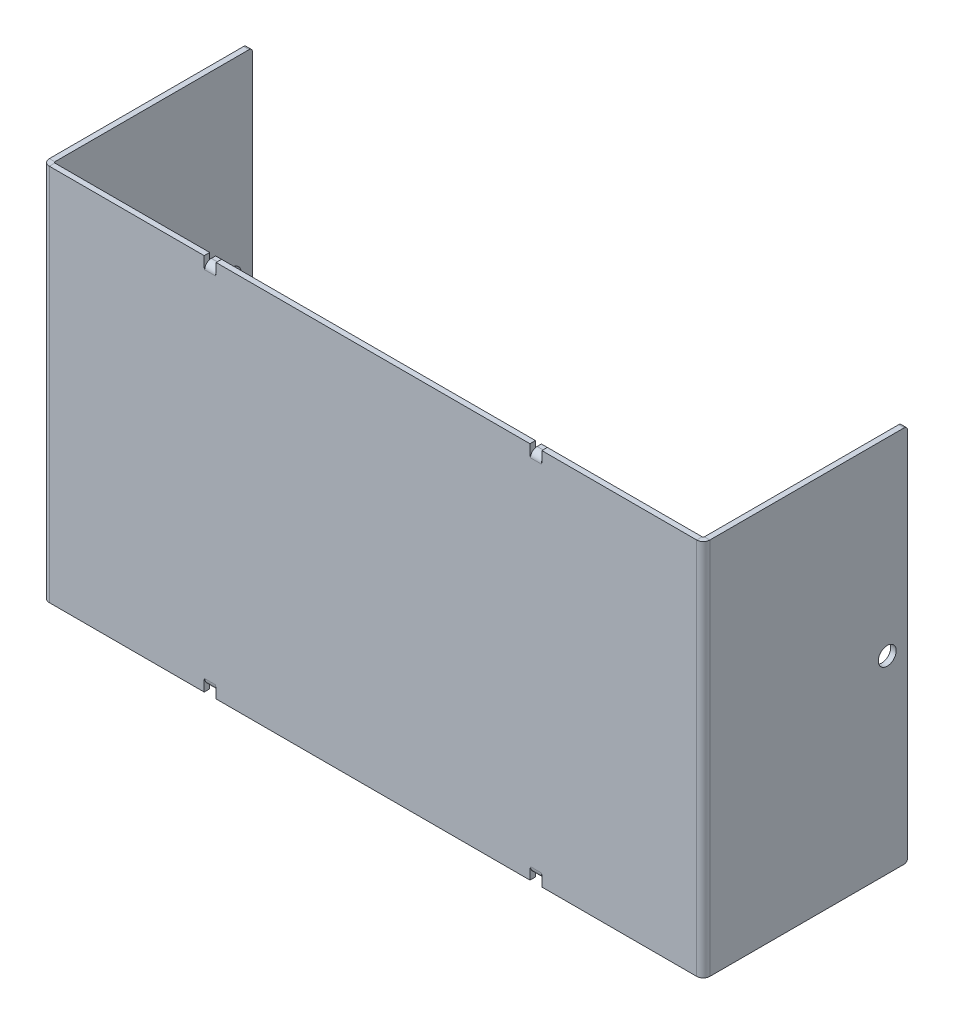
from build123d import *

# Parameters (mm, degrees)
SKETCH1_W                                    = 152.4
SKETCH1_H                                    = 88.9
BASE_FLANGE1_DEPTH                           = 1.29032
EDGE_FLANGE1_STRIP_W                         = 5.85978
EDGE_FLANGE1_STRIP_H                         = 1.29032
EDGE_FLANGE1_STRIP_CUT_DEPTH                 = 88.9
EDGE_FLANGE1_STRIP_2_W                       = 5.85978
EDGE_FLANGE1_STRIP_2_H                       = 1.29032
EDGE_FLANGE1_STRIP_CUT_2_DEPTH               = 88.9
EDGE_FLANGE1_DEPTH                           = 88.9
EDGE_FLANGE1_BEND_DEPTH                      = 88.9
F_4_22MM_HOLE_FOR_M3_CLINCH_NUT_D            = 4.22
BREAK_CORNER1_START                          = -77.68082
BREAK_CORNER1_DEPTH                          = 155.36164
CUT_THICKEN1_START                           = 41.91
CUT_THICKEN1_OUTLINE_W                       = 0.127
CUT_THICKEN1_OUTLINE_H                       = 1.29032
CUT_THICKEN1_DEPTH                           = 2.54
CUT_THICKEN2_START                           = 41.91
CUT_THICKEN2_OUTLINE_W                       = 0.127
CUT_THICKEN2_OUTLINE_H                       = 1.29032
CUT_THICKEN2_DEPTH                           = 2.54
MIRROR7_START                                = 41.91
MIRROR7_COPY_1_SKETCH_W                      = 0.127
MIRROR7_COPY_1_SKETCH_H                      = 1.29032
MIRROR7_COPY_1_DEPTH                         = 2.54
MIRROR7_COPY_2_SKETCH_W                      = 0.127
MIRROR7_COPY_2_SKETCH_H                      = 1.29032
MIRROR7_COPY_2_DEPTH                         = 2.54
MOVE_FACE1_BY                                = 1.27
MOVE_FACE1_2_BY                              = 1.27
MOVE_FACE1_3_BY                              = 1.27
MOVE_FACE1_4_BY                              = 1.27
EDGE_FLANGE2_STRIP_W                         = 5.66928
EDGE_FLANGE2_STRIP_H                         = 1.29032
EDGE_FLANGE2_STRIP_CUT_DEPTH                 = 2.54
EDGE_FLANGE2_STRIP_2_W                       = 5.66928
EDGE_FLANGE2_STRIP_2_H                       = 1.29032
EDGE_FLANGE2_STRIP_CUT_2_DEPTH               = 2.54
EDGE_FLANGE2_STRIP_3_W                       = 5.66928
EDGE_FLANGE2_STRIP_3_H                       = 1.29032
EDGE_FLANGE2_STRIP_CUT_3_DEPTH               = 2.54
EDGE_FLANGE2_STRIP_4_W                       = 5.66928
EDGE_FLANGE2_STRIP_4_H                       = 1.29032
EDGE_FLANGE2_STRIP_CUT_4_DEPTH               = 2.54
EDGE_FLANGE2_DEPTH                           = 2.54
EDGE_FLANGE2_BEND_DEPTH                      = 2.54
EDGE_FLANGE2_BEND_2_DEPTH                    = 2.54
EDGE_FLANGE2_BEND_3_DEPTH                    = 2.54
CHANGE_START                                 = -77.68082
CHANGE_NOTE_FOR_REVH_TO_ADD_010_CLEARA_DEPTH = 155.36164


# Read off the part's stored shape, not the designer's step: Break-Corner1, Cut-Thicken1, Cut-Thicken2, change note for revH to add .010" clearance
# Sheet-metal steps are written as plain solids
with BuildPart() as part:
    # Sketch1 → Base-Flange1 (new body)
    with BuildSketch(Plane.XY):
        Rectangle(SKETCH1_W, SKETCH1_H)
    extrude(amount=-BASE_FLANGE1_DEPTH)

    # Edge-Flange1 strip (across the edge) → Edge-Flange1 strip cut (cut)
    with BuildSketch(Plane(origin=(-76.3905, -44.45, -1.29032), x_dir=(1, 0, 0), z_dir=(0, 1, 0))):
        with Locations((-2.67589, -0.64516)):
            Rectangle(EDGE_FLANGE1_STRIP_W, EDGE_FLANGE1_STRIP_H)
    extrude(amount=EDGE_FLANGE1_STRIP_CUT_DEPTH, mode=Mode.SUBTRACT)

    # Edge-Flange1 strip 2 (across the edge) → Edge-Flange1 strip cut 2 (cut)
    with BuildSketch(Plane(origin=(76.3905, 44.45, -1.29032), x_dir=(-1, 0, 0), z_dir=(0, -1, 0))):
        with Locations((-2.67589, -0.64516)):
            Rectangle(EDGE_FLANGE1_STRIP_2_W, EDGE_FLANGE1_STRIP_2_H)
    extrude(amount=EDGE_FLANGE1_STRIP_CUT_2_DEPTH, mode=Mode.SUBTRACT)

    # Edge-Flange1 section (across the edge) → Edge-Flange1 (add)
    with BuildSketch(Plane(origin=(-76.3905, -44.45, -1.29032), x_dir=(1, 0, 0), z_dir=(0, 1, 0))):
        with BuildLine():
            Line((-1.29032, 0.254), (-1.29032, 46.96968))
            Line((-1.29032, 46.96968), (0, 46.96968))
            Line((0, 46.96968), (0, 0.254))
            ThreePointArc((0, 0.254), (0.074394878, 0.074394878), (0.254, 0))
            Line((0.254, 0), (0.254, -1.29032))
            ThreePointArc((0.254, -1.29032), (-0.837999144, -0.837999144), (-1.29032, 0.254))
        make_face()
    extrude(amount=EDGE_FLANGE1_DEPTH)

    # Edge-Flange1 section 2 (across the edge) → Edge-Flange1 bend (add)
    with BuildSketch(Plane(origin=(76.3905, 44.45, -1.29032), x_dir=(-1, 0, 0), z_dir=(0, -1, 0))):
        with BuildLine():
            Line((-1.29032, 0.254), (-1.29032, 46.96968))
            Line((-1.29032, 46.96968), (0, 46.96968))
            Line((0, 46.96968), (0, 0.254))
            ThreePointArc((0, 0.254), (0.074394878, 0.074394878), (0.254, 0))
            Line((0.254, 0), (0.254, -1.29032))
            ThreePointArc((0.254, -1.29032), (-0.837999144, -0.837999144), (-1.29032, 0.254))
        make_face()
    extrude(amount=EDGE_FLANGE1_BEND_DEPTH)

    # Ø4.22mm hole for M3 Clinch nut (through all)
    with Locations(Plane.ZY.offset(77.68082)):
        with Locations((-43.26, 0)):
            f_4_22mm_hole_for_m3_clinch_nut = Hole(F_4_22MM_HOLE_FOR_M3_CLINCH_NUT_D / 2)

    # Mirror1: Ø4.22mm hole for M3 Clinch nut across plane
    add(f_4_22mm_hole_for_m3_clinch_nut.mirror(Plane(origin=(0, 0, 0), x_dir=(0, 0, 1), z_dir=(1, 0, 0))), mode=Mode.SUBTRACT)

    # Break-Corner1 outline → Break-Corner1 (cut)
    with BuildSketch(Plane.YZ.offset(BREAK_CORNER1_START)):
        with BuildLine():
            Line((44.45, -48.26), (44.45, -47.498))
            ThreePointArc((44.45, -47.498), (44.226815367, -48.036815367), (43.688, -48.26))
            Line((43.688, -48.26), (44.45, -48.26))
        make_face()
        with BuildLine():
            Line((-44.45, -48.26), (-43.688, -48.26))
            ThreePointArc((-43.688, -48.26), (-44.226815367, -48.036815367), (-44.45, -47.498))
            Line((-44.45, -47.498), (-44.45, -48.26))
        make_face()
    extrude(amount=BREAK_CORNER1_DEPTH, mode=Mode.SUBTRACT)

    # Cut-Thicken1 outline → Cut-Thicken1 (cut)
    with BuildSketch(Plane(origin=(0, 0, 0), x_dir=(1, 0, 0), z_dir=(0, 1, 0)).offset(CUT_THICKEN1_START)):
        with Locations((36.97732, 0.64516)):
            Rectangle(CUT_THICKEN1_OUTLINE_W, CUT_THICKEN1_OUTLINE_H)
    cut_thicken1 = extrude(amount=CUT_THICKEN1_DEPTH, mode=Mode.SUBTRACT)

    # Cut-Thicken2 outline → Cut-Thicken2 (cut)
    with BuildSketch(Plane(origin=(0, 0, 0), x_dir=(1, 0, 0), z_dir=(0, 1, 0)).offset(CUT_THICKEN2_START)):
        with Locations((39.64432, 0.64516)):
            Rectangle(CUT_THICKEN2_OUTLINE_W, CUT_THICKEN2_OUTLINE_H)
    cut_thicken2 = extrude(amount=CUT_THICKEN2_DEPTH, mode=Mode.SUBTRACT)

    # Mirror6: Cut-Thicken1, Cut-Thicken2 across plane
    add(cut_thicken1.mirror(Plane(origin=(0, 0, 0), x_dir=(0, 0, 1), z_dir=(1, 0, 0))), mode=Mode.SUBTRACT)
    add(cut_thicken2.mirror(Plane(origin=(0, 0, 0), x_dir=(0, 0, 1), z_dir=(1, 0, 0))), mode=Mode.SUBTRACT)

    # Mirror7: Cut-Thicken1, Cut-Thicken2 across plane
    add(cut_thicken1.mirror(Plane.ZX), mode=Mode.SUBTRACT)
    add(cut_thicken2.mirror(Plane.ZX), mode=Mode.SUBTRACT)

    # Mirror7 copy 1 sketch → Mirror7 copy 1 (cut)
    with BuildSketch(Plane(origin=(0, 0, 0), x_dir=(-1, 0, 0), z_dir=(0, -1, 0)).offset(MIRROR7_START)):
        with Locations((36.97732, 0.64516)):
            Rectangle(MIRROR7_COPY_1_SKETCH_W, MIRROR7_COPY_1_SKETCH_H)
    extrude(amount=MIRROR7_COPY_1_DEPTH, mode=Mode.SUBTRACT)

    # Mirror7 copy 2 sketch → Mirror7 copy 2 (cut)
    with BuildSketch(Plane(origin=(0, 0, 0), x_dir=(-1, 0, 0), z_dir=(0, -1, 0)).offset(MIRROR7_START)):
        with Locations((39.64432, 0.64516)):
            Rectangle(MIRROR7_COPY_2_SKETCH_W, MIRROR7_COPY_2_SKETCH_H)
    extrude(amount=MIRROR7_COPY_2_DEPTH, mode=Mode.SUBTRACT)

    # Move Face1: a face moved inward by 1.27
    extrude(part.faces().sort_by_distance((-38.31082, -44.45, -0.64516))[0], amount=MOVE_FACE1_BY, dir=(0, 1, 0), mode=Mode.SUBTRACT)

    # Move Face1 2: a face moved inward by 1.27
    extrude(part.faces().sort_by_distance((38.31082, -44.45, -0.64516))[0], amount=MOVE_FACE1_2_BY, dir=(0, 1, 0), mode=Mode.SUBTRACT)

    # Move Face1 3: a face moved inward by 1.27
    extrude(part.faces().sort_by_distance((-38.31082, 44.45, -0.64516))[0], amount=MOVE_FACE1_3_BY, dir=(0, -1, 0), mode=Mode.SUBTRACT)

    # Move Face1 4: a face moved inward by 1.27
    extrude(part.faces().sort_by_distance((38.31082, 44.45, -0.64516))[0], amount=MOVE_FACE1_4_BY, dir=(0, -1, 0), mode=Mode.SUBTRACT)

    # Edge-Flange2 strip (across the edge) → Edge-Flange2 strip cut (cut)
    with BuildSketch(Plane(origin=(37.04082, 43.18, -1.29032), x_dir=(0, -1, 0), z_dir=(1, 0, 0))):
        with Locations((-1.29032, -0.64516)):
            Rectangle(EDGE_FLANGE2_STRIP_W, EDGE_FLANGE2_STRIP_H)
    extrude(amount=EDGE_FLANGE2_STRIP_CUT_DEPTH, mode=Mode.SUBTRACT)

    # Edge-Flange2 strip 2 (across the edge) → Edge-Flange2 strip cut 2 (cut)
    with BuildSketch(Plane(origin=(-39.58082, 43.18, -1.29032), x_dir=(0, -1, 0), z_dir=(1, 0, 0))):
        with Locations((-1.29032, -0.64516)):
            Rectangle(EDGE_FLANGE2_STRIP_2_W, EDGE_FLANGE2_STRIP_2_H)
    extrude(amount=EDGE_FLANGE2_STRIP_CUT_2_DEPTH, mode=Mode.SUBTRACT)

    # Edge-Flange2 strip 3 (across the edge) → Edge-Flange2 strip cut 3 (cut)
    with BuildSketch(Plane(origin=(39.58082, -43.18, -1.29032), x_dir=(0, 1, 0), z_dir=(-1, 0, 0))):
        with Locations((-1.29032, -0.64516)):
            Rectangle(EDGE_FLANGE2_STRIP_3_W, EDGE_FLANGE2_STRIP_3_H)
    extrude(amount=EDGE_FLANGE2_STRIP_CUT_3_DEPTH, mode=Mode.SUBTRACT)

    # Edge-Flange2 strip 4 (across the edge) → Edge-Flange2 strip cut 4 (cut)
    with BuildSketch(Plane(origin=(-37.04082, -43.18, -1.29032), x_dir=(0, 1, 0), z_dir=(-1, 0, 0))):
        with Locations((-1.29032, -0.64516)):
            Rectangle(EDGE_FLANGE2_STRIP_4_W, EDGE_FLANGE2_STRIP_4_H)
    extrude(amount=EDGE_FLANGE2_STRIP_CUT_4_DEPTH, mode=Mode.SUBTRACT)

    # Edge-Flange2 section (across the edge) → Edge-Flange2 (add)
    with BuildSketch(Plane(origin=(37.04082, 43.18, -1.29032), x_dir=(0, -1, 0), z_dir=(1, 0, 0))):
        with BuildLine():
            Line((0, 0.254), (0, 1.27))
            Line((0, 1.27), (1.29032, 1.27))
            Line((1.29032, 1.27), (1.29032, 0.254))
            ThreePointArc((1.29032, 0.254), (1.364714878, 0.074394878), (1.54432, 0))
            Line((1.54432, 0), (1.54432, -1.29032))
            ThreePointArc((1.54432, -1.29032), (0.452320856, -0.837999144), (0, 0.254))
        make_face()
    extrude(amount=EDGE_FLANGE2_DEPTH)

    # Edge-Flange2 section 2 (across the edge) → Edge-Flange2 bend (add)
    with BuildSketch(Plane(origin=(-39.58082, 43.18, -1.29032), x_dir=(0, -1, 0), z_dir=(1, 0, 0))):
        with BuildLine():
            Line((0, 0.254), (0, 1.27))
            Line((0, 1.27), (1.29032, 1.27))
            Line((1.29032, 1.27), (1.29032, 0.254))
            ThreePointArc((1.29032, 0.254), (1.364714878, 0.074394878), (1.54432, 0))
            Line((1.54432, 0), (1.54432, -1.29032))
            ThreePointArc((1.54432, -1.29032), (0.452320856, -0.837999144), (0, 0.254))
        make_face()
    extrude(amount=EDGE_FLANGE2_BEND_DEPTH)

    # Edge-Flange2 section 3 (across the edge) → Edge-Flange2 bend 2 (add)
    with BuildSketch(Plane(origin=(39.58082, -43.18, -1.29032), x_dir=(0, 1, 0), z_dir=(-1, 0, 0))):
        with BuildLine():
            Line((0, 0.254), (0, 1.27))
            Line((0, 1.27), (1.29032, 1.27))
            Line((1.29032, 1.27), (1.29032, 0.254))
            ThreePointArc((1.29032, 0.254), (1.364714878, 0.074394878), (1.54432, 0))
            Line((1.54432, 0), (1.54432, -1.29032))
            ThreePointArc((1.54432, -1.29032), (0.452320856, -0.837999144), (0, 0.254))
        make_face()
    extrude(amount=EDGE_FLANGE2_BEND_2_DEPTH)

    # Edge-Flange2 section 4 (across the edge) → Edge-Flange2 bend 3 (add)
    with BuildSketch(Plane(origin=(-37.04082, -43.18, -1.29032), x_dir=(0, 1, 0), z_dir=(-1, 0, 0))):
        with BuildLine():
            Line((0, 0.254), (0, 1.27))
            Line((0, 1.27), (1.29032, 1.27))
            Line((1.29032, 1.27), (1.29032, 0.254))
            ThreePointArc((1.29032, 0.254), (1.364714878, 0.074394878), (1.54432, 0))
            Line((1.54432, 0), (1.54432, -1.29032))
            ThreePointArc((1.54432, -1.29032), (0.452320856, -0.837999144), (0, 0.254))
        make_face()
    extrude(amount=EDGE_FLANGE2_BEND_3_DEPTH)

    # change note for revH to add .010_ cl 2 → change note for revH to add .010" clearance (cut)
    with BuildSketch(Plane.YZ.offset(CHANGE_START)):
        with BuildLine():
            Line((43.688, -48.006), (-43.688, -48.006))
            ThreePointArc((-43.688, -48.006), (-44.226815367, -47.782815367), (-44.45, -47.244))
            Line((-44.45, -47.244), (-44.45, -47.498))
            ThreePointArc((-44.45, -47.498), (-44.226815367, -48.036815367), (-43.688, -48.26))
            Line((-43.688, -48.26), (43.688, -48.26))
            ThreePointArc((43.688, -48.26), (44.226815367, -48.036815367), (44.45, -47.498))
            Line((44.45, -47.498), (44.45, -47.244))
            ThreePointArc((44.45, -47.244), (44.226815367, -47.782815367), (43.688, -48.006))
        make_face()
    extrude(amount=CHANGE_NOTE_FOR_REVH_TO_ADD_010_CLEARA_DEPTH, mode=Mode.SUBTRACT)


solid = part.part
